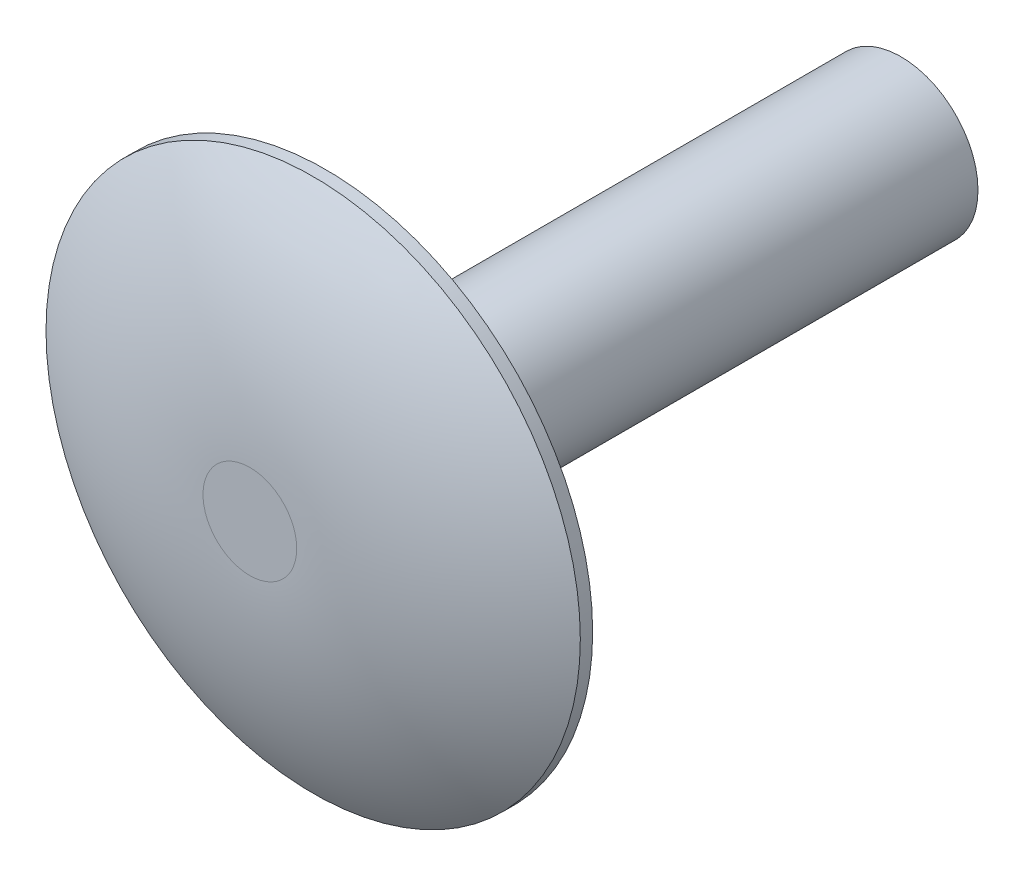
from build123d import *

# Parameters (mm, degrees)
SKETCH1_R           = 8.255
BOSS_EXTRUDE1_DEPTH = 2.3368
SKETCH2_R           = 2.38125
BOSS_EXTRUDE2_DEPTH = 17.78


with BuildPart() as part:
    # Sketch1 → Boss-Extrude1 (new body)
    with BuildSketch(Plane.XY):
        Circle(SKETCH1_R)
    extrude(amount=BOSS_EXTRUDE1_DEPTH)

    # Sketch2 → Boss-Extrude2 (add)
    with BuildSketch(Plane.XY):
        Circle(SKETCH2_R)
    extrude(amount=-BOSS_EXTRUDE2_DEPTH)

    # Sketch3 → Cut-Revolve1 (revolve, cut)
    with BuildSketch(Plane(origin=(0, 0, 0), x_dir=(1, 0, 0), z_dir=(0, 1, 0))):
        with BuildLine():
            Line((8.255, -2.3368), (8.255, -0.381))
            ThreePointArc((8.255, -0.381), (4.989096566, -1.838155581), (1.4478, -2.3368))
            Line((1.4478, -2.3368), (8.255, -2.3368))
        make_face()
    revolve(axis=Axis((0, 0, 2.3368), (0, 0, -1)), mode=Mode.SUBTRACT)


solid = part.part
